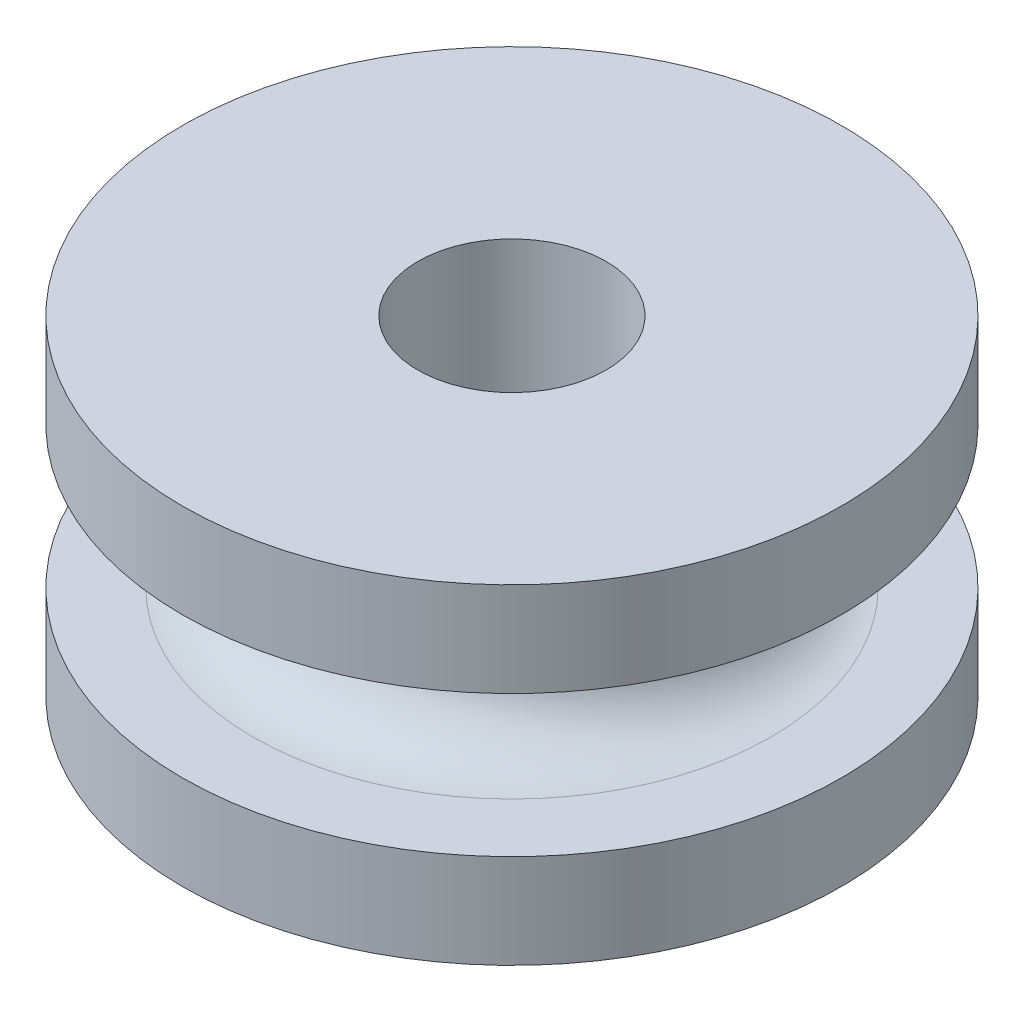
from build123d import *

# Parameters (mm, degrees)
SKETCH_2_R          = 2
CUT_EXTRUDE_1_DEPTH = 13.124355653


with BuildPart() as part:
    # ｽｹｯﾁ1 → 回転1 (revolve)
    with BuildSketch(Plane.XY):
        with BuildLine():
            Line((0, 3.5), (-7, 3.5))
            Line((-7, 3.5), (-7, 1.5))
            Line((-7, 1.5), (-5.5, 1.5))
            ThreePointArc((-5.5, 1.5), (-4, 0), (-5.5, -1.5))
            Line((-5.5, -1.5), (-7, -1.5))
            Line((-7, -1.5), (-7, -3.5))
            Line((-7, -3.5), (0, -3.5))
            Line((0, -3.5), (0, 3.5))
        make_face()
    revolve(axis=Axis((0, 3.5, 0), (0, -1, 0)))

    # ｽｹｯﾁ2 → ｶｯﾄ - 押し出し1 (cut, through all)
    with BuildSketch(Plane.XZ.offset(3.5)):
        Circle(SKETCH_2_R)
    extrude(amount=-CUT_EXTRUDE_1_DEPTH, mode=Mode.SUBTRACT)


solid = part.part
